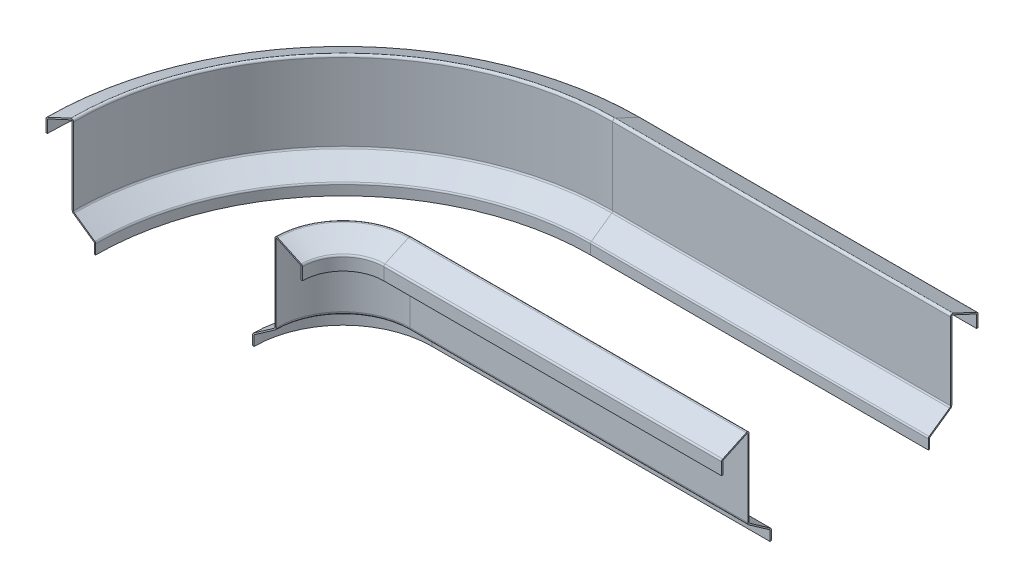
from build123d import *


with BuildPart() as part:
    # Sweep1: sweep along a path in Sketch8
    with BuildLine(Plane(origin=(0, 55, 0), x_dir=(1, 0, 0), z_dir=(0, 1, 0))) as sweep1_path:
        Line((750, 225), (250, 225))
        ThreePointArc((250, 225), (73.223304703, 151.776695297), (0, -25))
    # Sketch6 → Sweep1 (sweep)
    with BuildSketch(Plane.XY.offset(25)):
        with BuildLine():
            Line((-118.233918228, -26.066459757), (-118.233918228, -40.504758606))
            Line((-118.233918228, -40.504758606), (-116.233918228, -40.504758606))
            Line((-116.233918228, -40.504758606), (-116.233918228, -26.066459757))
            ThreePointArc((-116.233918228, -26.066459757), (-116.572885729, -24.681213918), (-117.513188919, -23.609003624))
            Line((-117.513188919, -23.609003624), (-147.720729309, -2.457456133))
            ThreePointArc((-147.720729309, -2.457456133), (-148.6610325, -1.38524584), (-149, 0))
            Line((-149, 0), (-149, 113.729242117))
            ThreePointArc((-149, 113.729242117), (-150.388101175, 116.259416454), (-153.267854785, 116.448165478))
            Line((-153.267854785, 116.448165478), (-188.051705202, 100.228189649))
            ThreePointArc((-188.051705202, 100.228189649), (-189.314024754, 99.121165113), (-189.783850417, 97.509266288))
            Line((-189.783850417, 97.509266288), (-189.783850417, 79.42047707))
            Line((-189.783850417, 79.42047707), (-187.783850417, 79.42047707))
            Line((-187.783850417, 79.42047707), (-187.783850417, 97.509266288))
            ThreePointArc((-187.783850417, 97.509266288), (-187.627241862, 98.046565896), (-187.206468678, 98.415574075))
            Line((-187.206468678, 98.415574075), (-152.422618262, 114.635549904))
            ThreePointArc((-152.422618262, 114.635549904), (-151.462700392, 114.572633563), (-151, 113.729242117))
            Line((-151, 113.729242117), (-151, 0))
            ThreePointArc((-151, 0), (-150.435054166, -2.308743066), (-148.867882182, -4.095760221))
            Line((-148.867882182, -4.095760221), (-118.660341792, -25.247307713))
            ThreePointArc((-118.660341792, -25.247307713), (-118.346907395, -25.604711144), (-118.233918228, -26.066459757))
        make_face()
        with BuildLine():
            Line((148.867882182, -4.095760221), (118.660341792, -25.247307713))
            ThreePointArc((118.660341792, -25.247307713), (118.346907395, -25.604711144), (118.233918228, -26.066459757))
            Line((118.233918228, -26.066459757), (118.233918228, -40.504758606))
            Line((118.233918228, -40.504758606), (116.233918228, -40.504758606))
            Line((116.233918228, -40.504758606), (116.233918228, -26.066459757))
            ThreePointArc((116.233918228, -26.066459757), (116.572885729, -24.681213918), (117.513188919, -23.609003624))
            Line((117.513188919, -23.609003624), (147.720729309, -2.457456133))
            ThreePointArc((147.720729309, -2.457456133), (148.6610325, -1.38524584), (149, 0))
            Line((149, 0), (149, 113.729242117))
            ThreePointArc((149, 113.729242117), (150.388101175, 116.259416454), (153.267854785, 116.448165478))
            Line((153.267854785, 116.448165478), (188.051705202, 100.228189649))
            ThreePointArc((188.051705202, 100.228189649), (189.314024754, 99.121165113), (189.783850417, 97.509266288))
            Line((189.783850417, 97.509266288), (189.783850417, 79.42047707))
            Line((189.783850417, 79.42047707), (187.783850417, 79.42047707))
            Line((187.783850417, 79.42047707), (187.783850417, 97.509266288))
            ThreePointArc((187.783850417, 97.509266288), (187.627241862, 98.046565896), (187.206468678, 98.415574075))
            Line((187.206468678, 98.415574075), (152.422618262, 114.635549904))
            ThreePointArc((152.422618262, 114.635549904), (151.462700392, 114.572633563), (151, 113.729242117))
            Line((151, 113.729242117), (151, 0))
            ThreePointArc((151, 0), (150.435054166, -2.308743066), (148.867882182, -4.095760221))
        make_face()
    sweep(path=sweep1_path.line)


solid = part.part
